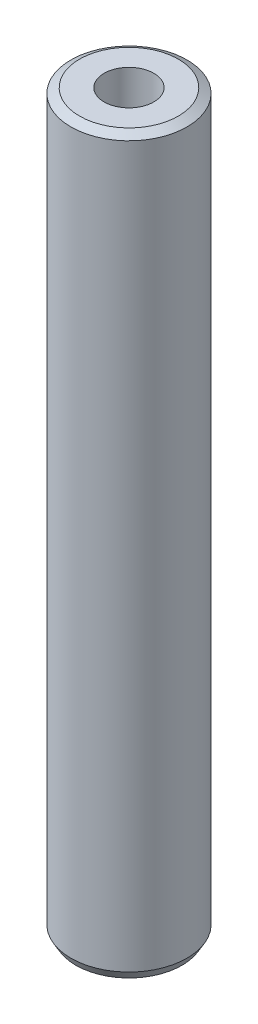
from build123d import *
from OCP.BRepFilletAPI import BRepFilletAPI_MakeChamfer

# Parameters (mm, degrees)
SKETCH1_R           = 47.5
BOSS_EXTRUDE1_DEPTH = 600
SKETCH2_R           = 20.33696929
CUT_EXTRUDE1_DEPTH  = 604.748706003
CHAMFER1_SIZE       = 4.109809737
CHAMFER1_SIZE2      = 7.118399274


with BuildPart() as part:
    # Sketch1 → Boss-Extrude1 (new body)
    with BuildSketch(Plane(origin=(0, 0, 0), x_dir=(1, 0, 0), z_dir=(0, 1, 0))):
        Circle(SKETCH1_R)
    extrude(amount=BOSS_EXTRUDE1_DEPTH)

    # Sketch2 → Cut-Extrude1 (cut, through all)
    with BuildSketch(Plane(origin=(0, 0, 0), x_dir=(1, 0, 0), z_dir=(0, 1, 0))):
        Circle(SKETCH2_R)
    extrude(amount=CUT_EXTRUDE1_DEPTH, mode=Mode.SUBTRACT)

    # Chamfer1: one chamfer whose edges measure the first distance from different faces: ONE call of the kernel's chamfer builder (chamfer() names one face for all edges)
    chamfer1_edges_1 = [part.edges().sort_by_distance(p)[0] for p in [
        (-47.5, 600, 0),
    ]]
    chamfer1_side_1 = [part.faces().sort_by_distance(p)[0] for p in [
        (-47.5, 300, 0),
    ]]
    chamfer1_edges_2 = [part.edges().sort_by_distance(p)[0] for p in [
        (-47.5, 0, 0),
    ]]
    chamfer1_side_2 = [part.faces().sort_by_distance(p)[0] for p in [
        (-46.156497116, 0, 0),
    ]]
    chamfer1 = BRepFilletAPI_MakeChamfer(part.part.solid().wrapped)
    for e in chamfer1_edges_1:
        chamfer1.Add(CHAMFER1_SIZE, CHAMFER1_SIZE2, e.wrapped, chamfer1_side_1[0].wrapped)  # the first distance lies on this face
    for e in chamfer1_edges_2:
        chamfer1.Add(CHAMFER1_SIZE, CHAMFER1_SIZE2, e.wrapped, chamfer1_side_2[0].wrapped)  # the first distance lies on this face
    add(Compound.cast(chamfer1.Shape()), mode=Mode.REPLACE)


solid = part.part
